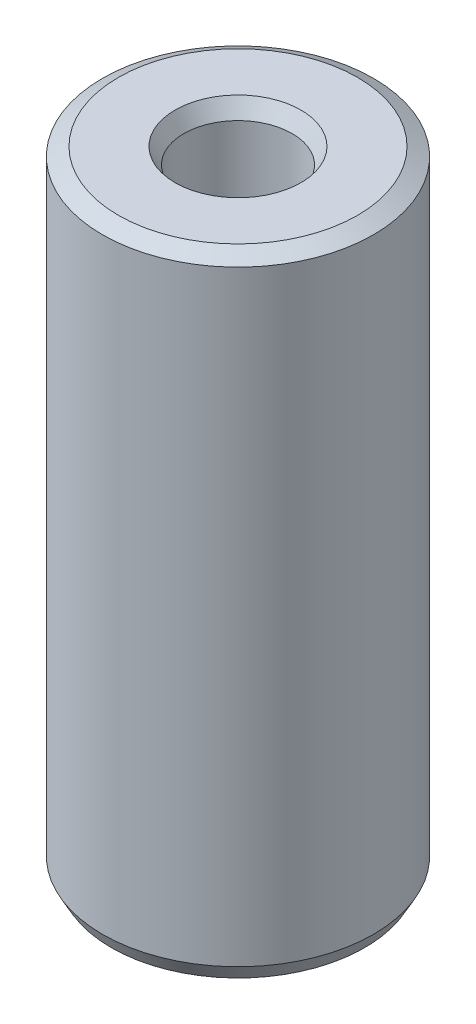
from build123d import *
from OCP.BRepFilletAPI import BRepFilletAPI_MakeChamfer

# Parameters (mm, degrees)
SKETCH1_R           = 20
BOSS_EXTRUDE1_DEPTH = 93.077222726
SKETCH2_R           = 7.991289773
CUT_EXTRUDE1_DEPTH  = 98.279850896
CHAMFER1_SIZE       = 1.299246731
CHAMFER1_SIZE2      = 2.357831326


with BuildPart() as part:
    # Sketch1 → Boss-Extrude1 (new body)
    with BuildSketch(Plane(origin=(0, 0, 0), x_dir=(1, 0, 0), z_dir=(0, 1, 0))):
        Circle(SKETCH1_R)
    extrude(amount=BOSS_EXTRUDE1_DEPTH)

    # Sketch2 → Cut-Extrude1 (cut, through all)
    with BuildSketch(Plane(origin=(0, 0, 0), x_dir=(1, 0, 0), z_dir=(0, 1, 0))):
        Circle(SKETCH2_R)
    extrude(amount=CUT_EXTRUDE1_DEPTH, mode=Mode.SUBTRACT)

    # Chamfer1: one chamfer whose edges measure the first distance from different faces: ONE call of the kernel's chamfer builder (chamfer() names one face for all edges)
    chamfer1_edges_1 = [part.edges().sort_by_distance(p)[0] for p in [
        (-7.991289773, 93.077222726, 0),
    ]]
    chamfer1_side_1 = [part.faces().sort_by_distance(p)[0] for p in [
        (-19.434314575, 93.077222726, 0),
    ]]
    chamfer1_edges_2 = [part.edges().sort_by_distance(p)[0] for p in [
        (-7.991289773, 0, 0),
    ]]
    chamfer1_side_2 = [part.faces().sort_by_distance(p)[0] for p in [
        (-7.991289773, 46.538611363, 0),
    ]]
    chamfer1_edges_3 = [part.edges().sort_by_distance(p)[0] for p in [
        (-20, 0, 0),
    ]]
    chamfer1_side_3 = [part.faces().sort_by_distance(p)[0] for p in [
        (-19.434314575, 0, 0),
    ]]
    chamfer1_edges_4 = [part.edges().sort_by_distance(p)[0] for p in [
        (-20, 93.077222726, 0),
    ]]
    chamfer1_side_4 = [part.faces().sort_by_distance(p)[0] for p in [
        (-20, 46.538611363, 0),
    ]]
    chamfer1 = BRepFilletAPI_MakeChamfer(part.part.solid().wrapped)
    for e in chamfer1_edges_1:
        chamfer1.Add(CHAMFER1_SIZE, CHAMFER1_SIZE2, e.wrapped, chamfer1_side_1[0].wrapped)  # the first distance lies on this face
    for e in chamfer1_edges_2:
        chamfer1.Add(CHAMFER1_SIZE, CHAMFER1_SIZE2, e.wrapped, chamfer1_side_2[0].wrapped)  # the first distance lies on this face
    for e in chamfer1_edges_3:
        chamfer1.Add(CHAMFER1_SIZE, CHAMFER1_SIZE2, e.wrapped, chamfer1_side_3[0].wrapped)  # the first distance lies on this face
    for e in chamfer1_edges_4:
        chamfer1.Add(CHAMFER1_SIZE, CHAMFER1_SIZE2, e.wrapped, chamfer1_side_4[0].wrapped)  # the first distance lies on this face
    add(Compound.cast(chamfer1.Shape()), mode=Mode.REPLACE)


solid = part.part
